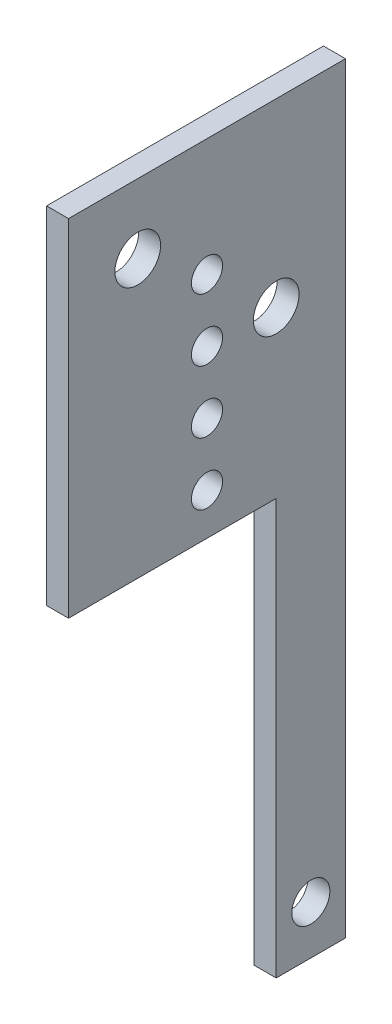
from build123d import *

# Parameters (mm, degrees)
SKETCH1_R           = 3.3
SKETCH1_R_2         = 2.25
SKETCH1_R_3         = 2.75
BOSS_EXTRUDE1_DEPTH = 3.175


with BuildPart() as part:
    # Sketch1 → Boss-Extrude1 (new body)
    with BuildSketch(Plane(origin=(0, 0, 0), x_dir=(0, 0, -1), z_dir=(1, 0, 0))):
        Polygon((40, 0), (0, 0), (0, -50), (30, -50), (30, -110), (40, -110), (40, -50), align=None)
        with Locations((30, -26.108433688)):
            Circle(SKETCH1_R, mode=Mode.SUBTRACT)
        with Locations((10, -10)):
            Circle(SKETCH1_R, mode=Mode.SUBTRACT)
        with Locations((20, -16.974849628)):
            Circle(SKETCH1_R_2, mode=Mode.SUBTRACT)
        with Locations((20, -25.974849628)):
            Circle(SKETCH1_R_2, mode=Mode.SUBTRACT)
        with Locations((20, -34.974849628)):
            Circle(SKETCH1_R_2, mode=Mode.SUBTRACT)
        with Locations((20, -43.974849628)):
            Circle(SKETCH1_R_2, mode=Mode.SUBTRACT)
        with Locations((35, -103)):
            Circle(SKETCH1_R_3, mode=Mode.SUBTRACT)
    extrude(amount=BOSS_EXTRUDE1_DEPTH)


solid = part.part
